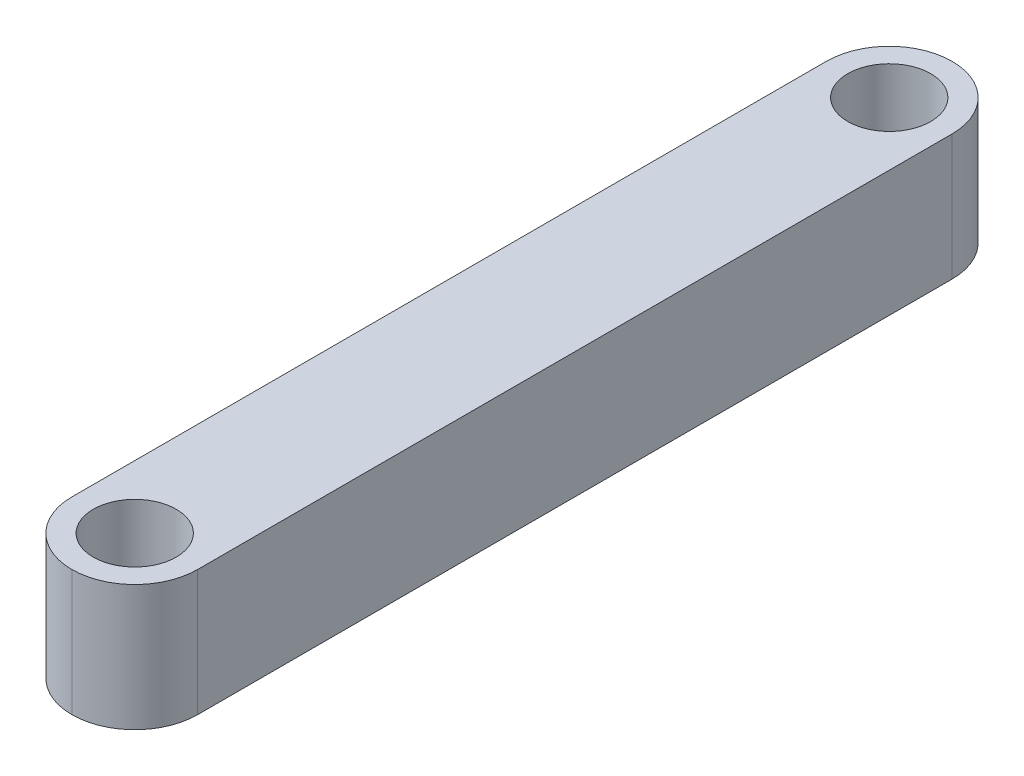
from build123d import *

# Parameters (mm, degrees)
SKETCH_2_W      = 50
SKETCH_2_H      = 350
SKETCH_2_R      = 16.5
EXTRUDE_2_DEPTH = 50
FILLET_1_R      = 25
FILLET_2_R      = 25


with BuildPart() as part:
    # 草图2 → 凸台-拉伸2 (new body)
    with BuildSketch(Plane(origin=(0, 0, 0), x_dir=(1, 0, 0), z_dir=(0, 1, 0))):
        with Locations((25, 175)):
            Rectangle(SKETCH_2_W, SKETCH_2_H)
        with Locations(Location((25, 25, 0), (0, 0, 270))):
            Circle(SKETCH_2_R, mode=Mode.SUBTRACT)
        with Locations(Location((25, 325, 0), (0, 0, 270))):
            Circle(SKETCH_2_R, mode=Mode.SUBTRACT)
    extrude(amount=EXTRUDE_2_DEPTH)

    # 圆角1
    fillet_1_edges = [part.edges().sort_by_distance(p)[0] for p in [
        (50, 25, 0),
        (0, 25, 0),
    ]]
    fillet(fillet_1_edges, radius=FILLET_1_R - 0.0001)  # a hair under: the kernel refuses the full size

    # 圆角2
    fillet_2_edges = [part.edges().sort_by_distance(p)[0] for p in [
        (50, 25, -350),
        (0, 25, -350),
    ]]
    fillet(fillet_2_edges, radius=FILLET_2_R - 0.0001)  # a hair under: the kernel refuses the full size


solid = part.part
